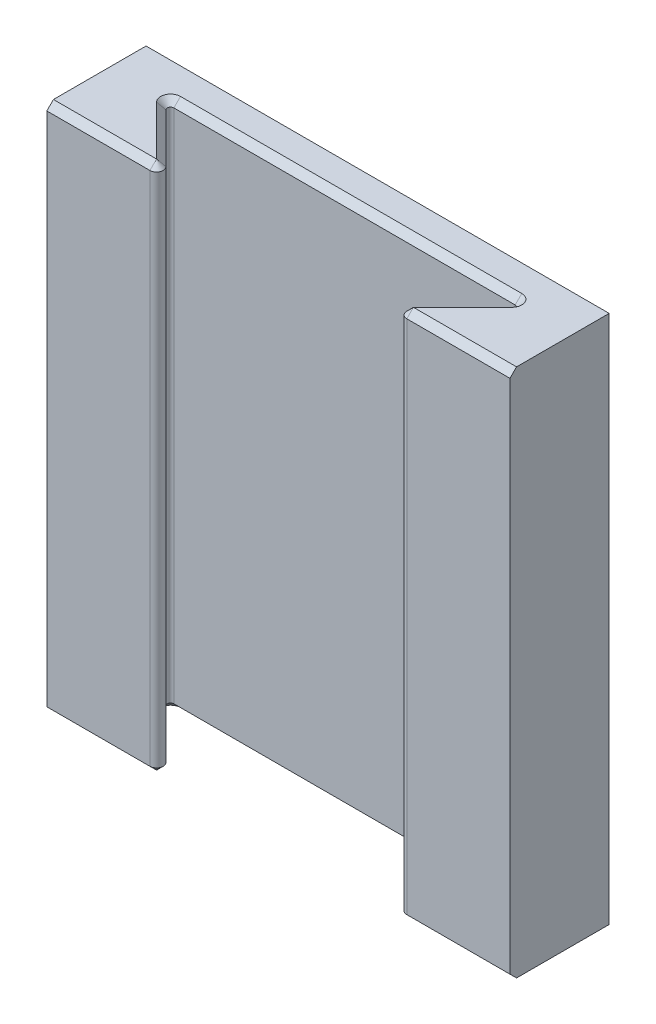
from build123d import *

# Parameters (mm, degrees)
SKETCH1_W           = 70
SKETCH1_H           = 80
BOSS_EXTRUDE1_DEPTH = 15
CUT_EXTRUDE1_DEPTH  = 108.354552768
FILLET1_R           = 0.5
FILLET2_R           = 1
CHAMFER1_SIZE       = 1


with BuildPart() as part:
    # Sketch1 → Boss-Extrude1 (new body)
    with BuildSketch(Plane.XY):
        with Locations((35, 40)):
            Rectangle(SKETCH1_W, SKETCH1_H)
    extrude(amount=BOSS_EXTRUDE1_DEPTH)

    # Sketch2 → Cut-Extrude1 (cut, through all)
    with BuildSketch(Plane.XZ):
        Polygon((18, 15), (8, 5), (62, 5), (52, 15), align=None)
    extrude(amount=-CUT_EXTRUDE1_DEPTH, mode=Mode.SUBTRACT)

    # Fillet1
    fillet1_edges = [part.edges().sort_by_distance(p)[0] for p in [
        (62, 40, 5),
        (8, 40, 5),
    ]]
    fillet(fillet1_edges, radius=FILLET1_R)

    # Fillet2
    fillet2_edges = [part.edges().sort_by_distance(p)[0] for p in [
        (52, 40, 15),
        (18, 40, 15),
    ]]
    fillet(fillet2_edges, radius=FILLET2_R)

    # Chamfer1
    chamfer1_edges = [part.edges().sort_by_distance(p)[0] for p in [
        (7.792893219, 80, 15),
        (62.207106781, 80, 15),
        (16.50966597, 80, 14.382683432),
        (53.49033403, 80, 14.382683432),
        (12.573223305, 80, 9.573223305),
        (57.426776695, 80, 9.573223305),
        (8.745167015, 80, 5.308658284),
        (61.254832985, 80, 5.308658284),
        (35, 80, 5),
        (7.792893219, 0, 15),
        (62.207106781, 0, 15),
        (16.50966597, 0, 14.382683432),
        (53.49033403, 0, 14.382683432),
        (12.573223305, 0, 9.573223305),
        (57.426776695, 0, 9.573223305),
        (8.745167015, 0, 5.308658284),
        (61.254832985, 0, 5.308658284),
        (35, 0, 5),
    ]]
    chamfer(chamfer1_edges, length=CHAMFER1_SIZE)


solid = part.part
